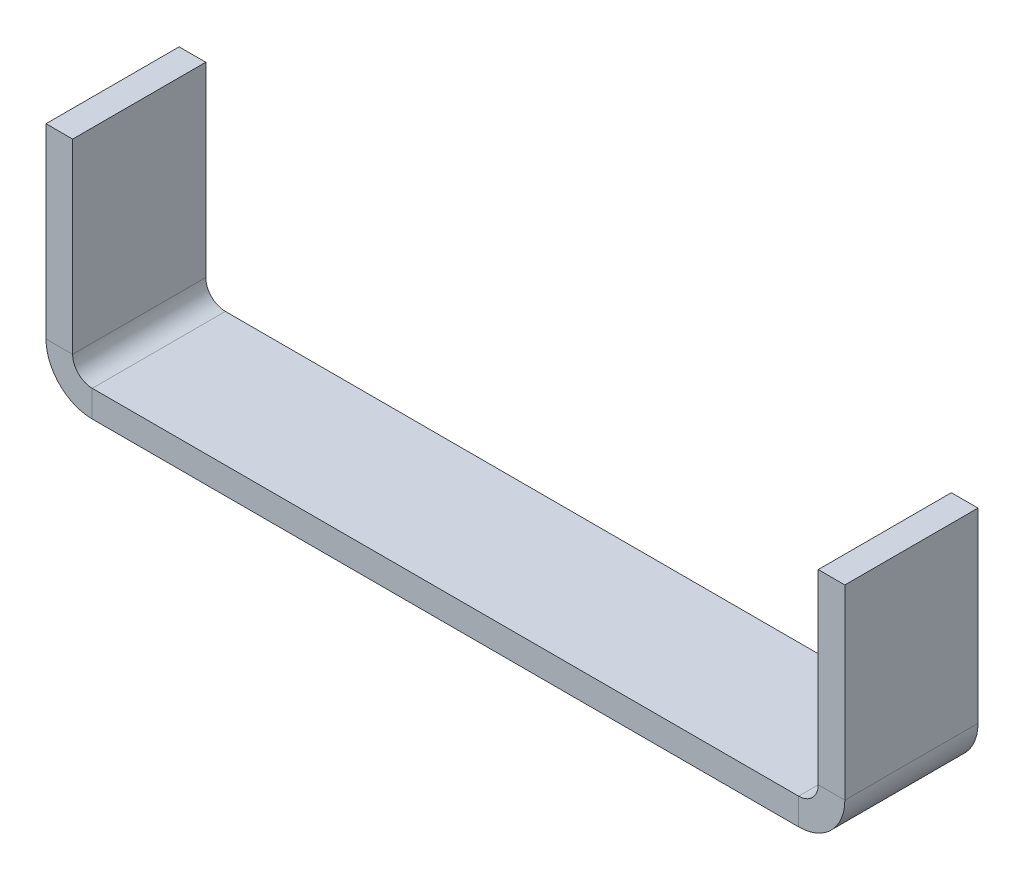
from build123d import *

# Parameters (mm, degrees)
SKETCH1_W                    = 30
SKETCH1_H                    = 5
BASE_FLANGE1_DEPTH           = 1
EDGE_FLANGE1_STRIP_W         = 5.4732
EDGE_FLANGE1_STRIP_H         = 1
EDGE_FLANGE1_STRIP_CUT_DEPTH = 5
EDGE_FLANGE1_DEPTH           = 5
EDGE_FLANGE2_STRIP_W         = 5.4732
EDGE_FLANGE2_STRIP_H         = 1
EDGE_FLANGE2_STRIP_CUT_DEPTH = 5
EDGE_FLANGE2_DEPTH           = 5


# Sheet-metal steps are written as plain solids
with BuildPart() as part:
    # Sketch1 → Base-Flange1 (new body)
    with BuildSketch(Plane(origin=(0, 0, 0), x_dir=(1, 0, 0), z_dir=(0, 1, 0))):
        Rectangle(SKETCH1_W, SKETCH1_H)
    extrude(amount=-BASE_FLANGE1_DEPTH)

    # Edge-Flange1 strip (across the edge) → Edge-Flange1 strip cut (cut)
    with BuildSketch(Plane(origin=(-15, 0, -2.5), x_dir=(1, 0, 0), z_dir=(0, 0, 1))):
        with Locations((-1, -0.5)):
            Rectangle(EDGE_FLANGE1_STRIP_W, EDGE_FLANGE1_STRIP_H)
    extrude(amount=EDGE_FLANGE1_STRIP_CUT_DEPTH, mode=Mode.SUBTRACT)

    # Edge-Flange1 section (across the edge) → Edge-Flange1 (add)
    with BuildSketch(Plane(origin=(-15, 0, -2.5), x_dir=(1, 0, 0), z_dir=(0, 0, 1))):
        with BuildLine():
            Line((0, 0.7366), (0, 7.7366))
            Line((0, 7.7366), (1, 7.7366))
            Line((1, 7.7366), (1, 0.7366))
            ThreePointArc((1, 0.7366), (1.215745145, 0.215745145), (1.7366, 0))
            Line((1.7366, 0), (1.7366, -1))
            ThreePointArc((1.7366, -1), (0.508638364, -0.491361636), (0, 0.7366))
        make_face()
    extrude(amount=EDGE_FLANGE1_DEPTH)

    # Edge-Flange2 strip (across the edge) → Edge-Flange2 strip cut (cut)
    with BuildSketch(Plane(origin=(15, 0, 2.5), x_dir=(-1, 0, 0), z_dir=(0, 0, -1))):
        with Locations((-1, -0.5)):
            Rectangle(EDGE_FLANGE2_STRIP_W, EDGE_FLANGE2_STRIP_H)
    extrude(amount=EDGE_FLANGE2_STRIP_CUT_DEPTH, mode=Mode.SUBTRACT)

    # Edge-Flange2 section (across the edge) → Edge-Flange2 (add)
    with BuildSketch(Plane(origin=(15, 0, 2.5), x_dir=(-1, 0, 0), z_dir=(0, 0, -1))):
        with BuildLine():
            Line((0, 0.7366), (0, 7.7366))
            Line((0, 7.7366), (1, 7.7366))
            Line((1, 7.7366), (1, 0.7366))
            ThreePointArc((1, 0.7366), (1.215745145, 0.215745145), (1.7366, 0))
            Line((1.7366, 0), (1.7366, -1))
            ThreePointArc((1.7366, -1), (0.508638364, -0.491361636), (0, 0.7366))
        make_face()
    extrude(amount=EDGE_FLANGE2_DEPTH)


solid = part.part
